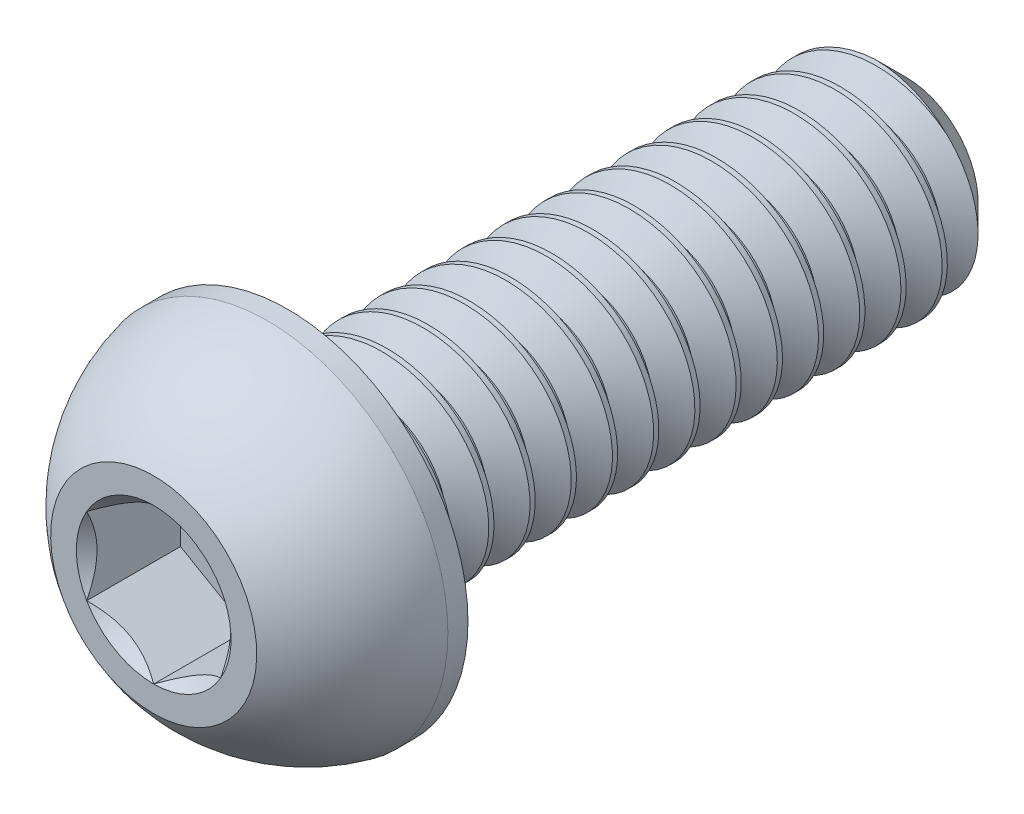
from build123d import *

# Parameters (mm, degrees)
SKETCH1_W          = 6
SKETCH1_H          = 1
CHAMFER1_SIZE      = 0.3
CUT_EXTRUDE2_DEPTH = 0.91
CUT_SWEEP1_PITCH   = 0.4


with BuildPart() as part:
    # Sketch1 → Revolve1 (revolve)
    with BuildSketch(Plane(origin=(0, 0, 0), x_dir=(0, 0, -1), z_dir=(1, 0, 0))):
        with Locations((4.3, 0.5)):
            Rectangle(SKETCH1_W, SKETCH1_H)
    revolve(axis=Axis((0, 0, -7.3), (0, 0, 1)))

    # Chamfer1
    chamfer1_edges = [part.edges().sort_by_distance(p)[0] for p in [
        (0, -1, -7.3),
    ]]
    chamfer(chamfer1_edges, length=CHAMFER1_SIZE)

    # Sketch7 → Revolve2 (revolve)
    with BuildSketch(Plane(origin=(0, 0, 0), x_dir=(0, 0, -1), z_dir=(1, 0, 0)), mode=Mode.PRIVATE) as revolve2_sk:
        with BuildLine():
            Line((1.105, 1.75), (1.3, 1.75))
            Line((1.3, 1.75), (1.3, 0))
            Line((1.3, 0), (0, 0))
            Line((0, 0), (0, 1))
            ThreePointArc((0, 1), (0.479976957, 1.481850617), (1.105, 1.75))
        make_face()
    revolve(revolve2_sk.sketch.rotate(Axis((0, 0, 0), (0, 0, -1)), 180), axis=Axis((0, 0, 0), (0, 0, -1)))

    # Sketch5 → Cut-Extrude2 (cut)
    with BuildSketch(Plane.XY):
        Polygon((0.65, -0.375277675), (0.65, 0.375277675), (0, 0.75055535), (-0.65, 0.375277675), (-0.65, -0.375277675), (0, -0.75055535), align=None)
    extrude(amount=-CUT_EXTRUDE2_DEPTH, mode=Mode.SUBTRACT)

    # Cut-Extrude3 cone 1 section (through the dimple's axis) → Cut-Extrude3 (revolve, cut)
    with BuildSketch(Plane(origin=(0, 0, 0), x_dir=(0, -1, 0), z_dir=(1, 0, 0))):
        Polygon((0, 0), (0.75055535, 0), (0, 0.75055535), align=None)
    revolve(axis=Axis((0, 0, 0), (0, 0, -1)), mode=Mode.SUBTRACT)

    # Cut-Sweep1: the profile of Sketch2 profile screwed along a right-hand helix of 16 turns, 6 arcs to a turn; built about Z, then put on its axis
    cut_sweep1_z = Axis((0, 0, 0), (0, 0, 1))
    cut_sweep1_corners = [(1.0003, 0, 0.300173205), (1.0003, 0, -0.050173205), (0.740192379, 0, 0.1), (0.740192379, 0, 0.15)]
    with BuildLine(mode=Mode.PRIVATE) as cut_sweep1_profile:
        Line(cut_sweep1_corners[0], cut_sweep1_corners[1])
        Line(cut_sweep1_corners[1], cut_sweep1_corners[2])
        Line(cut_sweep1_corners[2], cut_sweep1_corners[3])
        Line(cut_sweep1_corners[3], cut_sweep1_corners[0])
    cut_sweep1_cap = Face(cut_sweep1_profile.wire())
    cut_sweep1_turn_angles = [0, 30, 60, 90, 120, 150, 180, 210, 240, 270, 300, 330, 360]
    cut_sweep1_turn_weights = [1, 0.8660254037844387, 1, 0.8660254037844387, 1, 0.8660254037844387, 1, 0.8660254037844387, 1, 0.8660254037844387, 1, 0.8660254037844387, 1]
    cut_sweep1_turn_rails = [Edge.make_bspline([Vector(p[0], p[1], 0).rotate(cut_sweep1_z, cut_sweep1_turn_angles[k]) / cut_sweep1_turn_weights[k] + Vector(0, 0, p[2] + CUT_SWEEP1_PITCH * cut_sweep1_turn_angles[k] / 360) for k in range(13)], [0, 0, 0, 1, 1, 2, 2, 3, 3, 4, 4, 5, 5, 6, 6, 6], 2, cut_sweep1_turn_weights) for p in cut_sweep1_corners]
    cut_sweep1_turn_sides = [Face.make_surface_from_curves(cut_sweep1_turn_rails[p[0]], cut_sweep1_turn_rails[p[1]]) for p in [(0, 1), (1, 2), (2, 3), (3, 0)]]
    cut_sweep1 = Plane(origin=(0, 0, -7.3), x_dir=(0, 1, 0), z_dir=(0, 0, 1)) * Solid(Shell([*[p.moved(Location((0, 0, CUT_SWEEP1_PITCH * i))) for i in range(16) for p in cut_sweep1_turn_sides], cut_sweep1_cap, cut_sweep1_cap.rotate(cut_sweep1_z, 5760).moved(Location((0, 0, CUT_SWEEP1_PITCH * 5760 / 360)))]))
    add(cut_sweep1, mode=Mode.SUBTRACT)


solid = part.part
